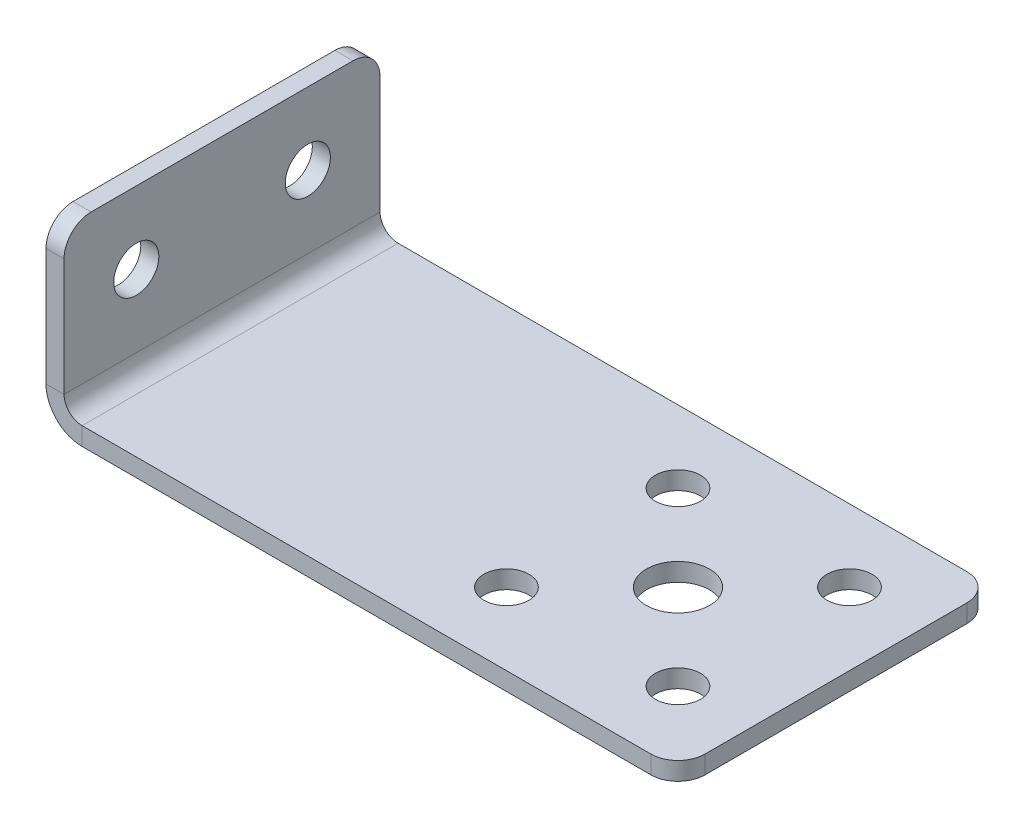
from build123d import *

# Parameters (mm, degrees)
SKETCH1_W                    = 70
SKETCH1_H                    = 35
BASE_FLANGE1_DEPTH           = 2
EDGE_FLANGE1_STRIP_W         = 12
EDGE_FLANGE1_STRIP_H         = 2
EDGE_FLANGE1_STRIP_CUT_DEPTH = 35
EDGE_FLANGE1_DEPTH           = 35
F_5_0MM_DOWEL_HOLE1_D        = 5
F_5_0MM_DOWEL_HOLE2_D        = 7
F_5_0MM_DOWEL_HOLE3_D        = 5
FILLET1_R                    = 3


# Sheet-metal steps are written as plain solids
with BuildPart() as part:
    # Sketch1 → Base-Flange1 (new body)
    with BuildSketch(Plane(origin=(0, 0, 0), x_dir=(1, 0, 0), z_dir=(0, 1, 0))):
        Rectangle(SKETCH1_W, SKETCH1_H)
    extrude(amount=BASE_FLANGE1_DEPTH)

    # Edge-Flange1 strip (across the edge) → Edge-Flange1 strip cut (cut)
    with BuildSketch(Plane(origin=(-35, 2, -17.5), x_dir=(1, 0, 0), z_dir=(0, 0, 1))):
        with Locations((-2, -1)):
            Rectangle(EDGE_FLANGE1_STRIP_W, EDGE_FLANGE1_STRIP_H)
    extrude(amount=EDGE_FLANGE1_STRIP_CUT_DEPTH, mode=Mode.SUBTRACT)

    # Edge-Flange1 section (across the edge) → Edge-Flange1 (add)
    with BuildSketch(Plane(origin=(-35, 2, -17.5), x_dir=(1, 0, 0), z_dir=(0, 0, 1))):
        with BuildLine():
            Line((0, 2), (0, 18))
            Line((0, 18), (2, 18))
            Line((2, 18), (2, 2))
            ThreePointArc((2, 2), (2.585786438, 0.585786438), (4, 0))
            Line((4, 0), (4, -2))
            ThreePointArc((4, -2), (1.171572875, -0.828427125), (0, 2))
        make_face()
    extrude(amount=EDGE_FLANGE1_DEPTH)

    # Ø5.0mm Dowel Hole1 (through all)
    with Locations(Plane(origin=(0, 2, 0), x_dir=(1, 0, 0), z_dir=(0, 1, 0))):
        with Locations((8, 9.5), (27, 9.5), (27, -9.5), (8, -9.5)):
            Hole(F_5_0MM_DOWEL_HOLE1_D / 2)

    # Ø5.0mm Dowel Hole2 (through all)
    with Locations(Plane(origin=(0, 2, 0), x_dir=(1, 0, 0), z_dir=(0, 1, 0))):
        with Locations((17.5, 0)):
            Hole(F_5_0MM_DOWEL_HOLE2_D / 2)

    # Ø5.0mm Dowel Hole3 (through all)
    with Locations(Plane(origin=(-33, 0, 0), x_dir=(0, 0, -1), z_dir=(1, 0, 0))):
        with Locations((-9.5, 12), (9.5, 12)):
            Hole(F_5_0MM_DOWEL_HOLE3_D / 2)

    # Fillet1
    fillet1_edges = [part.edges().sort_by_distance(p)[0] for p in [
        (-34, 20, -17.5),
        (-34, 20, 17.5),
        (35, 1, -17.5),
        (35, 1, 17.5),
    ]]
    fillet(fillet1_edges, radius=FILLET1_R)


solid = part.part
